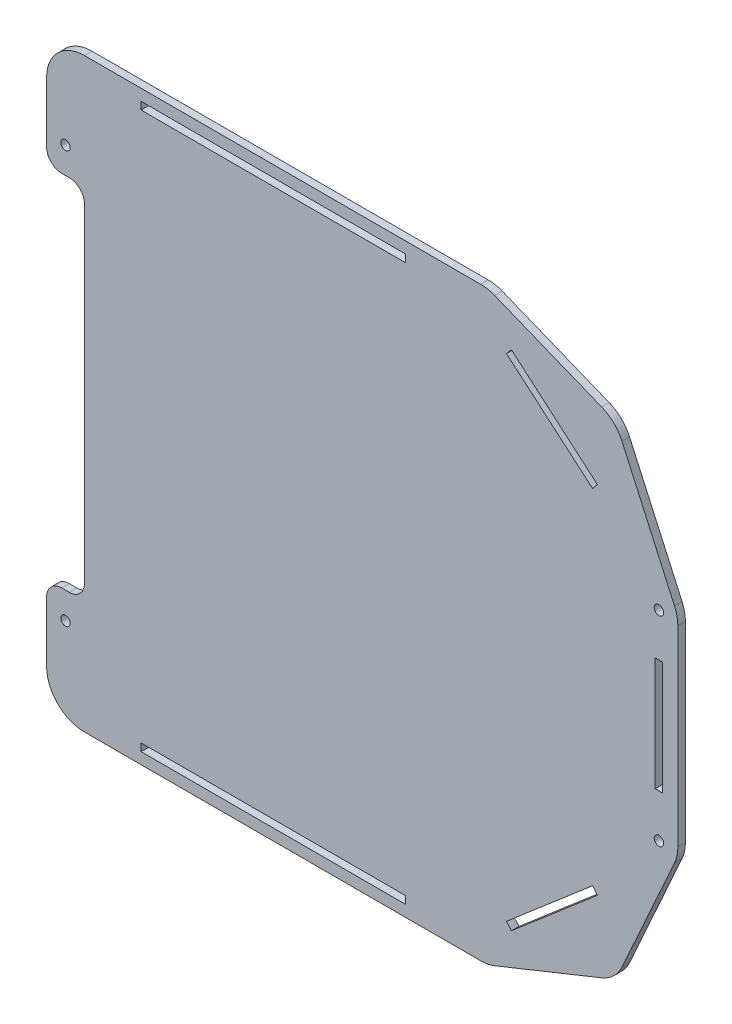
from build123d import *

# Parameters (mm, degrees)
ESTRUSIONE_ESTRUSIONE1_DEPTH = 2
FORO_FILETTATO_M3X0_5_1_D    = 2.5
SCHIZZO4_W                   = 70
SCHIZZO4_H                   = 2
TAGLIO_ESTRUSIONE1_DEPTH     = 10
FORO_FILETTATO_M3X0_5_2_D    = 2.5
SCHIZZO7_W                   = 2
SCHIZZO7_H                   = 30
TAGLIO_ESTRUSIONE2_DEPTH     = 10
SCHIZZO8_W                   = 10
SCHIZZO8_H                   = 95
TAGLIO_ESTRUSIONE3_DEPTH     = 10
RACCORDO1_R                  = 10
RACCORDO2_R                  = 10
RACCORDO3_R                  = 4


with BuildPart() as part:
    # Schizzo1 → Estrusione-Estrusione1 (new body)
    with BuildSketch(Plane.XY):
        Polygon((25.764676516, -77.5), (59.567435258, -63.90932479), (76, -27.5), (76, 27.5), (59.567435258, 63.90932479), (25.764676516, 77.5), (-91, 77.5), (-91, -77.5), align=None)
    extrude(amount=ESTRUSIONE_ESTRUSIONE1_DEPTH)

    # Foro filettato M3x0.5-1 (through all)
    with Locations(Plane(origin=(0, 0, 0), x_dir=(-1, 0, 0), z_dir=(0, 0, -1))):
        with Locations((86, -54.5), (86, 54.5)):
            Hole(FORO_FILETTATO_M3X0_5_1_D / 2)

    # Schizzo4 → Taglio-Estrusione1 (cut)
    with BuildSketch(Plane(origin=(0, 0, 0), x_dir=(-1, 0, 0), z_dir=(0, 0, -1))):
        with Locations((31, -73.5)):
            Rectangle(SCHIZZO4_W, SCHIZZO4_H)
        with Locations((31, 73.5)):
            Rectangle(SCHIZZO4_W, SCHIZZO4_H)
    extrude(amount=-TAGLIO_ESTRUSIONE1_DEPTH, mode=Mode.SUBTRACT)

    # Foro filettato M3x0.5-2 (through all)
    with Locations(Plane.XY.offset(2)):
        with Locations((71, 26.42393853), (71, -26.42393853)):
            Hole(FORO_FILETTATO_M3X0_5_2_D / 2)

    # Schizzo7 → Taglio-Estrusione2 (cut)
    with BuildSketch(Plane.XY.offset(2)):
        Polygon((31.967868601, 66.557014374), (54.746042814, 47.033828684), (53.444497101, 45.515283736), (30.666322888, 65.038469427), align=None)
        Polygon((53.444497101, -45.515283736), (30.666322888, -65.038469427), (31.967868601, -66.557014374), (54.746042814, -47.033828684), align=None)
        with Locations((71, 0)):
            Rectangle(SCHIZZO7_W, SCHIZZO7_H)
    extrude(amount=-TAGLIO_ESTRUSIONE2_DEPTH, mode=Mode.SUBTRACT)

    # Schizzo8 → Taglio-Estrusione3 (cut)
    with BuildSketch(Plane.XY.offset(2)):
        with Locations((-86, 0)):
            Rectangle(SCHIZZO8_W, SCHIZZO8_H)
    extrude(amount=-TAGLIO_ESTRUSIONE3_DEPTH, mode=Mode.SUBTRACT)

    # Raccordo1
    raccordo1_edges = [part.edges().sort_by_distance(p)[0] for p in [
        (-91, 77.5, 1),
        (-91, -77.5, 1),
    ]]
    fillet(raccordo1_edges, radius=RACCORDO1_R)

    # Raccordo2
    raccordo2_edges = [part.edges().sort_by_distance(p)[0] for p in [
        (25.764676516, -77.5, 1),
        (59.567435258, -63.90932479, 1),
        (76, -27.5, 1),
        (76, 27.5, 1),
        (59.567435258, 63.90932479, 1),
        (25.764676516, 77.5, 1),
    ]]
    fillet(raccordo2_edges, radius=RACCORDO2_R)

    # Raccordo3
    raccordo3_edges = [part.edges().sort_by_distance(p)[0] for p in [
        (-81, 47.5, 1),
        (-91, 47.5, 1),
        (-81, -47.5, 1),
        (-91, -47.5, 1),
    ]]
    fillet(raccordo3_edges, radius=RACCORDO3_R)


solid = part.part
